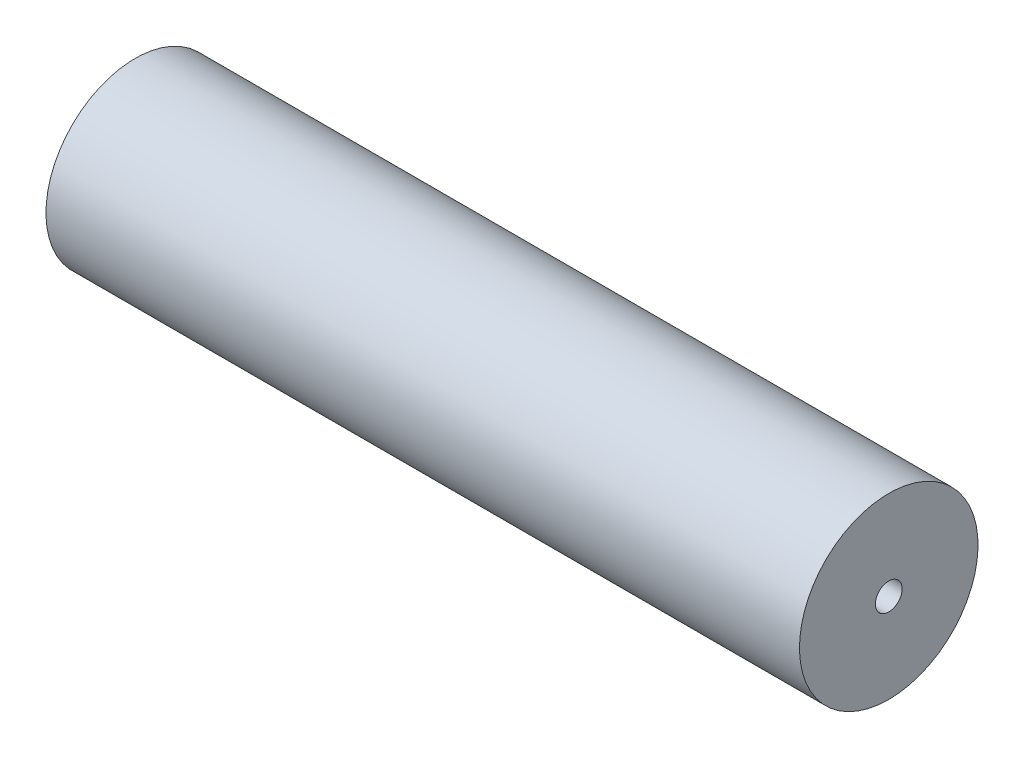
from build123d import *

# Parameters (mm, degrees)
ENL_V_MAT_EXTRU_1_REACH = 130.365
ESQUISSE2_R             = 2.25


with BuildPart() as part:
    # Esquisse1 → Révolution1 (revolve)
    with BuildSketch(Plane.XY):
        Polygon((-63.3, 15), (-63.3, 0), (63.3, 0), (63.3, 2.5), (63.3, 15), align=None)
    revolve(axis=Axis((-63.3, 0, 0), (1, 0, 0)))

    # Esquisse2 → Enlèv. mat.-Extru.1 (cut, up to next)
    with BuildSketch(Plane(origin=(63.3, 0, 0), x_dir=(0, 0, -1), z_dir=(1, 0, 0)), mode=Mode.PRIVATE) as enl_v_mat_extru_1_sk1:
        Circle(ESQUISSE2_R)
    enl_v_mat_extru_1_tool1 = extrude(enl_v_mat_extru_1_sk1.sketch, amount=-ENL_V_MAT_EXTRU_1_REACH, mode=Mode.PRIVATE) & part.part
    add(enl_v_mat_extru_1_tool1.solids().sort_by_distance((63.3, 0, 0))[0], mode=Mode.SUBTRACT)


solid = part.part
